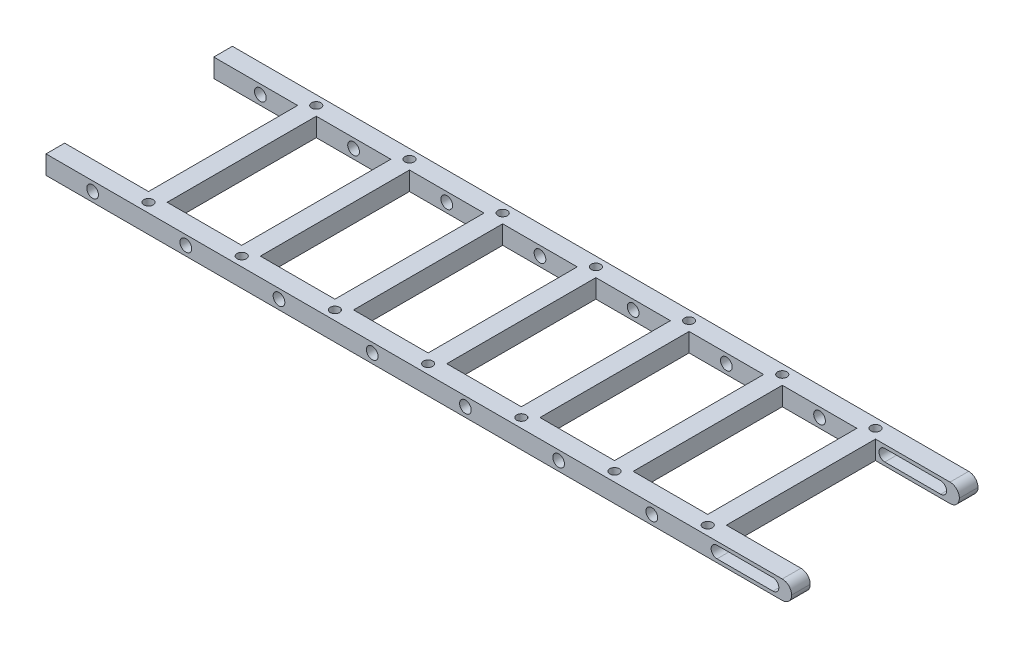
from build123d import *

# Parameters (mm, degrees)
SKETCH1_W           = 25.4
SKETCH1_H           = 50.8
BOSS_EXTRUDE1_DEPTH = 6.35
CUT_EXTRUDE1_REACH  = 144.132
SKETCH2_R           = 1.9939
CUT_EXTRUDE2_DEPTH  = 143.132235964
SKETCH4_R           = 1.5875
CUT_EXTRUDE3_DEPTH  = 132.062523247
FILLET1_R           = 3.175
SKETCH6_R           = 1.5875
CUT_EXTRUDE4_DEPTH  = 6.35


with BuildPart() as part:
    # Sketch1 → Boss-Extrude1 (new body)
    with BuildSketch(Plane(origin=(0, 0, 0), x_dir=(1, 0, 0), z_dir=(0, 1, 0))):
        Polygon((-127, 25.4), (-98.425, 25.4), (-98.425, -25.4), (-127, -25.4), (-127, -31.75), (127, -31.75), (127, -25.4), (98.425, -25.4), (98.425, 25.4), (127, 25.4), (127, 31.75), (-127, 31.75), align=None)
        with Locations((-15.875, 0)):
            Rectangle(SKETCH1_W, SKETCH1_H, mode=Mode.SUBTRACT)
        with Locations((-47.625, 0)):
            Rectangle(SKETCH1_W, SKETCH1_H, mode=Mode.SUBTRACT)
        with Locations((-79.375, 0)):
            Rectangle(SKETCH1_W, SKETCH1_H, mode=Mode.SUBTRACT)
        with Locations((79.375, 0)):
            Rectangle(SKETCH1_W, SKETCH1_H, mode=Mode.SUBTRACT)
        with Locations((47.625, 0)):
            Rectangle(SKETCH1_W, SKETCH1_H, mode=Mode.SUBTRACT)
        with Locations((15.875, 0)):
            Rectangle(SKETCH1_W, SKETCH1_H, mode=Mode.SUBTRACT)
    extrude(amount=-BOSS_EXTRUDE1_DEPTH)

    # Cut-Extrude1: up to this face of the body (flat: up to its plane)
    cut_extrude1_end = Plane(part.part.faces().sort_by_distance((0, -3.175, -31.75))[0])
    # Sketch2 → Cut-Extrude1 (cut, up to the picked face)
    with BuildSketch(Plane.XY.offset(31.75), mode=Mode.PRIVATE) as cut_extrude1_sk1:
        with Locations((-79.375, -3.175)):
            Circle(SKETCH2_R)
    cut_extrude1_tool1 = split(extrude(cut_extrude1_sk1.sketch, amount=-CUT_EXTRUDE1_REACH, mode=Mode.PRIVATE), bisect_by=cut_extrude1_end, keep=Keep.BOTH, mode=Mode.PRIVATE)
    # Sketch2 → Cut-Extrude1 (cut, up to the picked face)
    with BuildSketch(Plane.XY.offset(31.75), mode=Mode.PRIVATE) as cut_extrude1_sk2:
        with Locations((-47.625, -3.175)):
            Circle(SKETCH2_R)
    cut_extrude1_tool2 = split(extrude(cut_extrude1_sk2.sketch, amount=-CUT_EXTRUDE1_REACH, mode=Mode.PRIVATE), bisect_by=cut_extrude1_end, keep=Keep.BOTH, mode=Mode.PRIVATE)
    # Sketch2 → Cut-Extrude1 (cut, up to the picked face)
    with BuildSketch(Plane.XY.offset(31.75), mode=Mode.PRIVATE) as cut_extrude1_sk3:
        with Locations((-15.875, -3.175)):
            Circle(SKETCH2_R)
    cut_extrude1_tool3 = split(extrude(cut_extrude1_sk3.sketch, amount=-CUT_EXTRUDE1_REACH, mode=Mode.PRIVATE), bisect_by=cut_extrude1_end, keep=Keep.BOTH, mode=Mode.PRIVATE)
    # Sketch2 → Cut-Extrude1 (cut, up to the picked face)
    with BuildSketch(Plane.XY.offset(31.75), mode=Mode.PRIVATE) as cut_extrude1_sk4:
        with Locations((-111.125, -3.175)):
            Circle(SKETCH2_R)
    cut_extrude1_tool4 = split(extrude(cut_extrude1_sk4.sketch, amount=-CUT_EXTRUDE1_REACH, mode=Mode.PRIVATE), bisect_by=cut_extrude1_end, keep=Keep.BOTH, mode=Mode.PRIVATE)
    # Sketch2 → Cut-Extrude1 (cut, up to the picked face)
    with BuildSketch(Plane.XY.offset(31.75), mode=Mode.PRIVATE) as cut_extrude1_sk5:
        with Locations((15.875, -3.175)):
            Circle(SKETCH2_R)
    cut_extrude1_tool5 = split(extrude(cut_extrude1_sk5.sketch, amount=-CUT_EXTRUDE1_REACH, mode=Mode.PRIVATE), bisect_by=cut_extrude1_end, keep=Keep.BOTH, mode=Mode.PRIVATE)
    # Sketch2 → Cut-Extrude1 (cut, up to the picked face)
    with BuildSketch(Plane.XY.offset(31.75), mode=Mode.PRIVATE) as cut_extrude1_sk6:
        with Locations((47.625, -3.175)):
            Circle(SKETCH2_R)
    cut_extrude1_tool6 = split(extrude(cut_extrude1_sk6.sketch, amount=-CUT_EXTRUDE1_REACH, mode=Mode.PRIVATE), bisect_by=cut_extrude1_end, keep=Keep.BOTH, mode=Mode.PRIVATE)
    # Sketch2 → Cut-Extrude1 (cut, up to the picked face)
    with BuildSketch(Plane.XY.offset(31.75), mode=Mode.PRIVATE) as cut_extrude1_sk7:
        with Locations((79.375, -3.175)):
            Circle(SKETCH2_R)
    cut_extrude1_tool7 = split(extrude(cut_extrude1_sk7.sketch, amount=-CUT_EXTRUDE1_REACH, mode=Mode.PRIVATE), bisect_by=cut_extrude1_end, keep=Keep.BOTH, mode=Mode.PRIVATE)
    # Sketch2 → Cut-Extrude1 (cut, up to the picked face)
    with BuildSketch(Plane.XY.offset(31.75), mode=Mode.PRIVATE) as cut_extrude1_sk8:
        with Locations(Location((111.125, -3.175, 0), (0, 0, 180))):
            Circle(SKETCH2_R)
    cut_extrude1_tool8 = split(extrude(cut_extrude1_sk8.sketch, amount=-CUT_EXTRUDE1_REACH, mode=Mode.PRIVATE), bisect_by=cut_extrude1_end, keep=Keep.BOTH, mode=Mode.PRIVATE)
    add(cut_extrude1_tool1.solids().sort_by(Axis((-79.375, -3.175, 31.75), (0, 0, -1)))[0], mode=Mode.SUBTRACT)
    add(cut_extrude1_tool2.solids().sort_by(Axis((-47.625, -3.175, 31.75), (0, 0, -1)))[0], mode=Mode.SUBTRACT)
    add(cut_extrude1_tool3.solids().sort_by(Axis((-15.875, -3.175, 31.75), (0, 0, -1)))[0], mode=Mode.SUBTRACT)
    add(cut_extrude1_tool4.solids().sort_by(Axis((-111.125, -3.175, 31.75), (0, 0, -1)))[0], mode=Mode.SUBTRACT)
    add(cut_extrude1_tool5.solids().sort_by(Axis((15.875, -3.175, 31.75), (0, 0, -1)))[0], mode=Mode.SUBTRACT)
    add(cut_extrude1_tool6.solids().sort_by(Axis((47.625, -3.175, 31.75), (0, 0, -1)))[0], mode=Mode.SUBTRACT)
    add(cut_extrude1_tool7.solids().sort_by(Axis((79.375, -3.175, 31.75), (0, 0, -1)))[0], mode=Mode.SUBTRACT)
    add(cut_extrude1_tool8.solids().sort_by(Axis((111.125, -3.175, 31.75), (0, 0, -1)))[0], mode=Mode.SUBTRACT)

    # Sketch3 → Cut-Extrude2 (cut, through all)
    with BuildSketch(Plane.XY.offset(31.75)):
        with BuildLine():
            Line((101.6, -1.175), (120.65, -1.175))
            ThreePointArc((120.65, -1.175), (122.65, -3.175), (120.65, -5.175))
            Line((120.65, -5.175), (101.6, -5.175))
            ThreePointArc((101.6, -5.175), (99.6, -3.175), (101.6, -1.175))
        make_face()
    extrude(amount=-CUT_EXTRUDE2_DEPTH, mode=Mode.SUBTRACT)

    # Sketch4 → Cut-Extrude3 (cut, through all)
    with BuildSketch(Plane(origin=(0, 0, 0), x_dir=(1, 0, 0), z_dir=(0, 1, 0))):
        with Locations(Location((-95.25, 28.575, 0), (0, 0, 270))):
            Circle(SKETCH4_R)
        with Locations(Location((-63.5, 28.575, 0), (0, 0, 270))):
            Circle(SKETCH4_R)
        with Locations(Location((-31.75, 28.575, 0), (0, 0, 270))):
            Circle(SKETCH4_R)
        with Locations(Location((0, 28.575, 0), (0, 0, 270))):
            Circle(SKETCH4_R)
        with Locations(Location((31.75, 28.575, 0), (0, 0, 270))):
            Circle(SKETCH4_R)
        with Locations(Location((63.5, 28.575, 0), (0, 0, 270))):
            Circle(SKETCH4_R)
        with Locations(Location((95.25, 28.575, 0), (0, 0, 270))):
            Circle(SKETCH4_R)
        with Locations(Location((95.25, -28.575, 0), (0, 0, 90))):
            Circle(SKETCH4_R)
        with Locations(Location((63.5, -28.575, 0), (0, 0, 90))):
            Circle(SKETCH4_R)
        with Locations(Location((31.75, -28.575, 0), (0, 0, 90))):
            Circle(SKETCH4_R)
        with Locations(Location((0, -28.575, 0), (0, 0, 90))):
            Circle(SKETCH4_R)
        with Locations(Location((-31.75, -28.575, 0), (0, 0, 90))):
            Circle(SKETCH4_R)
        with Locations(Location((-63.5, -28.575, 0), (0, 0, 90))):
            Circle(SKETCH4_R)
        with Locations(Location((-95.25, -28.575, 0), (0, 0, 90))):
            Circle(SKETCH4_R)
    extrude(amount=-CUT_EXTRUDE3_DEPTH, mode=Mode.SUBTRACT)

    # Fillet1
    fillet1_edges = [part.edges().sort_by_distance(p)[0] for p in [
        (127, -6.35, -28.575),
        (127, 0, -28.575),
        (127, -6.35, 28.575),
        (127, 0, 28.575),
    ]]
    fillet(fillet1_edges, radius=FILLET1_R - 0.0001)  # a hair under: the kernel refuses the full size

    # Sketch6 → Cut-Extrude4 (cut)
    with BuildSketch(Plane.ZY.offset(127)):
        with Locations((-28.575, -3.175)):
            Circle(SKETCH6_R)
        with Locations((28.575, -3.175)):
            Circle(SKETCH6_R)
    extrude(amount=-CUT_EXTRUDE4_DEPTH, mode=Mode.SUBTRACT)


solid = part.part
